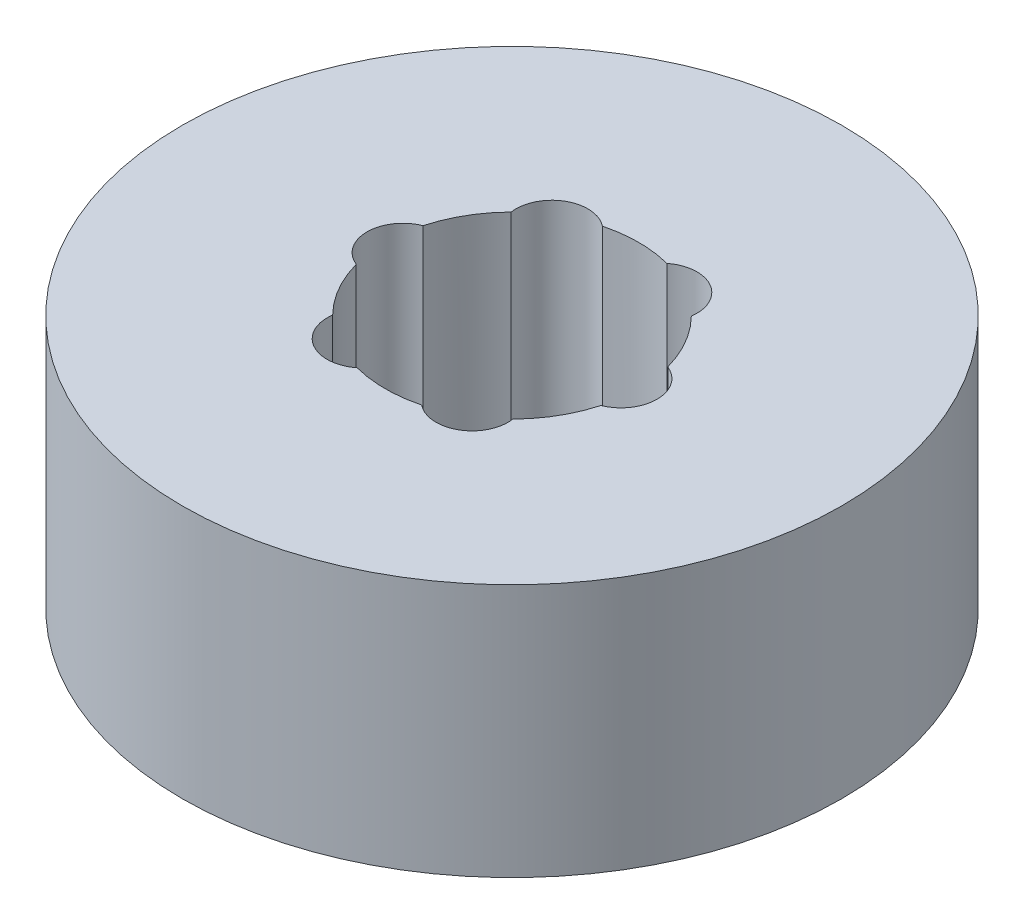
from build123d import *

# Parameters (mm, degrees)
SKETCH1_R           = 32.5
BOSS_EXTRUDE1_DEPTH = 25
SKETCH2_R           = 12.5
CUT_EXTRUDE1_DEPTH  = 53.321123841
SKETCH3_R           = 3.545473372
CUT_EXTRUDE2_DEPTH  = 19.207201728
CIRPATTERN1_COUNT   = 6


with BuildPart() as part:
    # Sketch1 → Boss-Extrude1 (new body)
    with BuildSketch(Plane(origin=(0, 0, 0), x_dir=(1, 0, 0), z_dir=(0, 1, 0))):
        Circle(SKETCH1_R)
    extrude(amount=BOSS_EXTRUDE1_DEPTH)

    # Sketch2 → Cut-Extrude1 (cut, through all)
    with BuildSketch(Plane(origin=(0, 0, 0), x_dir=(1, 0, 0), z_dir=(0, 1, 0))):
        Circle(SKETCH2_R)
    extrude(amount=CUT_EXTRUDE1_DEPTH, mode=Mode.SUBTRACT)

    # Sketch3 → Cut-Extrude2 (cut)
    with BuildSketch(Plane(origin=(0, 25, 0), x_dir=(1, 0, 0), z_dir=(0, 1, 0))):
        with Locations((-10.749796291, 0)):
            Circle(SKETCH3_R)
    cut_extrude2 = extrude(amount=-CUT_EXTRUDE2_DEPTH, mode=Mode.SUBTRACT)

    # CirPattern1: Cut-Extrude2 ×6 about axis
    cirpattern1_axis = Axis((0, 0, 0), (0, 1, 0))
    for i in range(1, CIRPATTERN1_COUNT):
        add(cut_extrude2.rotate(cirpattern1_axis, i * 360 / CIRPATTERN1_COUNT), mode=Mode.SUBTRACT)


solid = part.part
